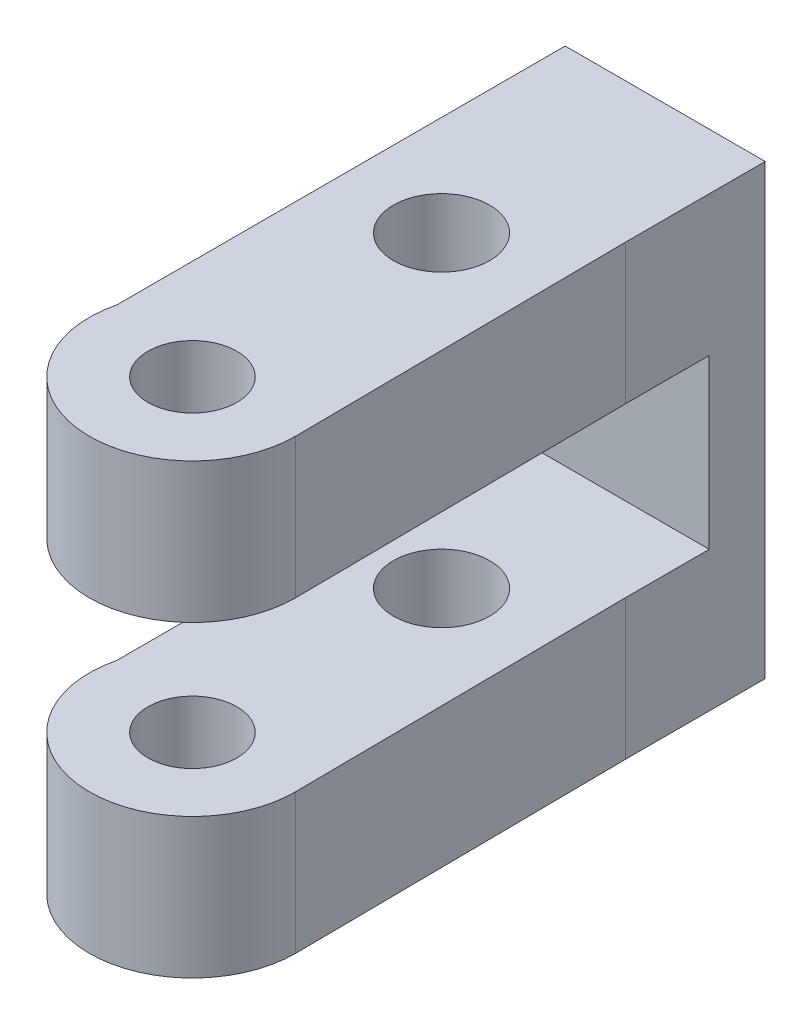
from build123d import *

# Parameters (mm, degrees)
CROQUIS2_R              = 1.720307827
CROQUIS2_R_2            = 1.5875
SALIENTE_EXTRUIR1_DEPTH = 5
CROQUIS2_4_W            = 7.146105916
CROQUIS2_4_H            = 2
SALIENTE_EXTRUIR2_DEPTH = 11
SALIENTE_EXTRUIR3_START = -11
CROQUIS2_5_R            = 1.720307827
CROQUIS2_5_R_2          = 1.5875
SALIENTE_EXTRUIR3_DEPTH = 5


with BuildPart() as part:
    # Croquis2 → Saliente-Extruir1 (new body)
    with BuildSketch(Plane(origin=(0, 0, 0), x_dir=(1, 0, 0), z_dir=(0, 1, 0))):
        with BuildLine():
            ThreePointArc((46.426947042, 35), (49.564233927, 30.472202028), (53.685223181, 34.127468235))
            Line((53.685223181, 34.127468235), (53.573052958, 46.021630377))
            Line((53.573052958, 46.021630377), (53.573052958, 49.021630377))
            Line((53.573052958, 49.021630377), (46.426947042, 49.021630377))
            Line((46.426947042, 49.021630377), (46.426947042, 35))
        make_face()
        with Locations((50, 43.030352088)):
            Circle(CROQUIS2_R, mode=Mode.SUBTRACT)
        with Locations((50.003640725, 34.127468235)):
            Circle(CROQUIS2_R_2, mode=Mode.SUBTRACT)
    extrude(amount=-SALIENTE_EXTRUIR1_DEPTH)

    # Croquis2<4> → Saliente-Extruir2 (add)
    with BuildSketch(Plane(origin=(0, 0, 0), x_dir=(1, 0, 0), z_dir=(0, 1, 0))):
        with Locations((50, 50.021630377)):
            Rectangle(CROQUIS2_4_W, CROQUIS2_4_H)
    extrude(amount=-SALIENTE_EXTRUIR2_DEPTH)

    # Croquis2<5> → Saliente-Extruir3 (add)
    with BuildSketch(Plane(origin=(0, 0, 0), x_dir=(1, 0, 0), z_dir=(0, 1, 0)).offset(SALIENTE_EXTRUIR3_START)):
        with BuildLine():
            ThreePointArc((46.426947042, 35), (49.564233927, 30.472202028), (53.685223181, 34.127468235))
            Line((53.685223181, 34.127468235), (53.573052958, 46.021630377))
            Line((53.573052958, 46.021630377), (53.573052958, 51.021630377))
            Line((53.573052958, 51.021630377), (46.426947042, 51.021630377))
            Line((46.426947042, 51.021630377), (46.426947042, 35))
        make_face()
        with Locations((50, 43.030352088)):
            Circle(CROQUIS2_5_R, mode=Mode.SUBTRACT)
        with Locations((50.003640725, 34.127468235)):
            Circle(CROQUIS2_5_R_2, mode=Mode.SUBTRACT)
    extrude(amount=-SALIENTE_EXTRUIR3_DEPTH)


solid = part.part
